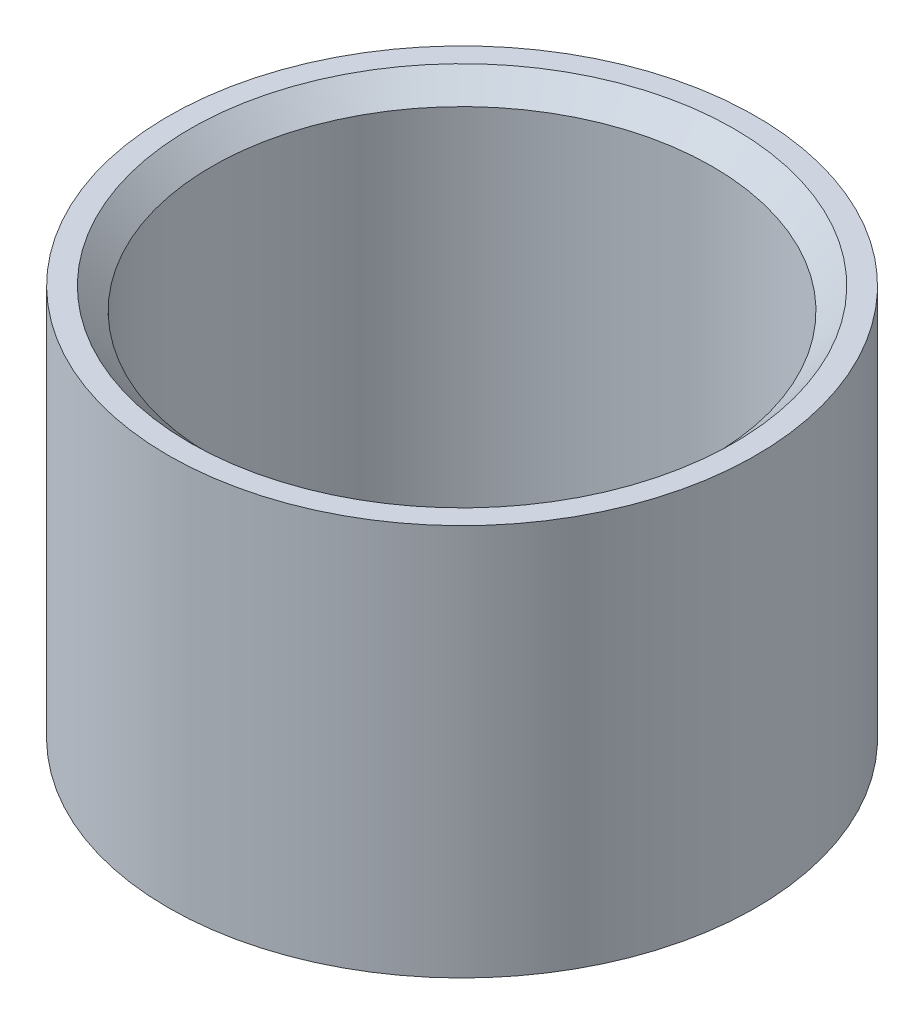
from build123d import *

# Parameters (mm, degrees)
SKETCH1_R           = 1.35
BOSS_EXTRUDE1_DEPTH = 1.8
CUT_EXTRUDE1_REACH  = 4.624
SKETCH2_R           = 1.15
CHAMFER1_SIZE       = 0.1


with BuildPart() as part:
    # Sketch1 → Boss-Extrude1 (new body)
    with BuildSketch(Plane(origin=(0, 0, 0), x_dir=(1, 0, 0), z_dir=(0, 1, 0))):
        Circle(SKETCH1_R)
    extrude(amount=BOSS_EXTRUDE1_DEPTH)

    # Sketch2 → Cut-Extrude1 (cut, up to next)
    with BuildSketch(Plane(origin=(0, 1.8, 0), x_dir=(1, 0, 0), z_dir=(0, 1, 0)), mode=Mode.PRIVATE) as cut_extrude1_sk1:
        Circle(SKETCH2_R)
    cut_extrude1_tool1 = extrude(cut_extrude1_sk1.sketch, amount=-CUT_EXTRUDE1_REACH, mode=Mode.PRIVATE) & part.part
    add(cut_extrude1_tool1.solids().sort_by_distance((0, 1.8, 0))[0], mode=Mode.SUBTRACT)

    # Chamfer1
    chamfer1_edges = [part.edges().sort_by_distance(p)[0] for p in [
        (-1.15, 1.8, 0),
    ]]
    chamfer(chamfer1_edges, length=CHAMFER1_SIZE)


solid = part.part
